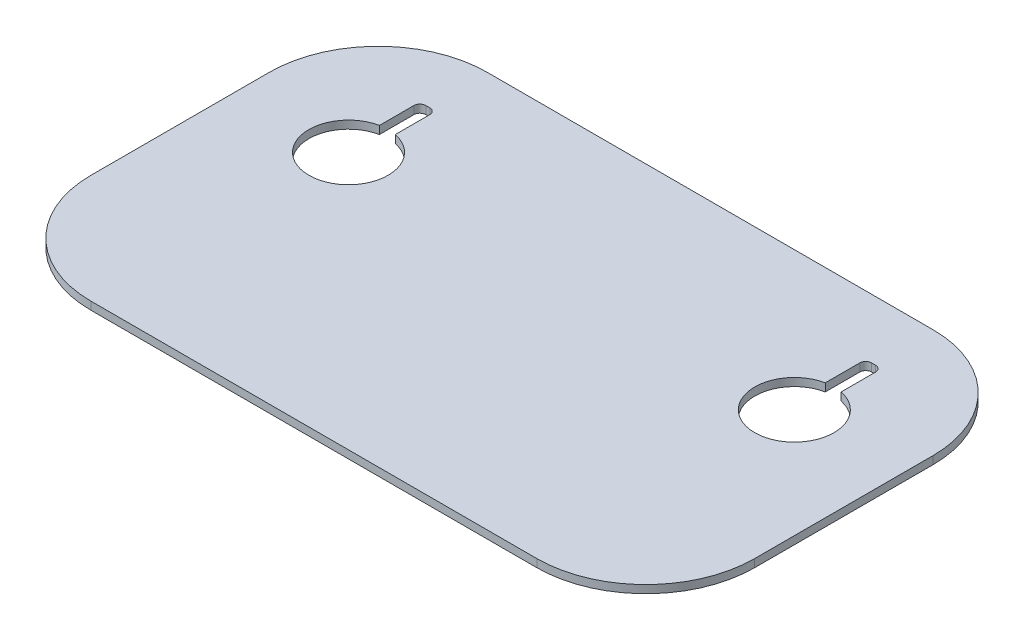
from build123d import *

# Parameters (mm, degrees)
BOSS_EXTRUDE1_DEPTH = 4
CUT_EXTRUDE1_DEPTH  = 391.180727356


with BuildPart() as part:
    # Sketch1 → Boss-Extrude1 (new body)
    with BuildSketch(Plane(origin=(0, 0, 0), x_dir=(1, 0, 0), z_dir=(0, 1, 0))):
        with BuildLine():
            Line((55, 0), (280, 0))
            ThreePointArc((280, 0), (318.890872965, 16.109127035), (335, 55))
            Line((335, 55), (335, 145))
            ThreePointArc((335, 145), (318.890872965, 183.890872965), (280, 200))
            Line((280, 200), (55, 200))
            ThreePointArc((55, 200), (16.109127035, 183.890872965), (0, 145))
            Line((0, 145), (0, 55))
            ThreePointArc((0, 55), (16.109127035, 16.109127035), (55, 0))
        make_face()
    extrude(amount=BOSS_EXTRUDE1_DEPTH)

    # Sketch3 → Cut-Extrude1 (cut, through all)
    with BuildSketch(Plane(origin=(0, 4, 0), x_dir=(1, 0, 0), z_dir=(0, 1, 0))):
        with BuildLine():
            Line((51, 167), (51, 149.595917942))
            ThreePointArc((51, 149.595917942), (55, 110), (59, 149.595917942))
            Line((59, 149.595917942), (59, 167))
            ThreePointArc((59, 167), (58.121320344, 169.121320344), (56, 170))
            Line((56, 170), (54, 170))
            ThreePointArc((54, 170), (51.878679656, 169.121320344), (51, 167))
        make_face()
        with BuildLine():
            Line((284, 167), (284, 149.595917942))
            ThreePointArc((284, 149.595917942), (280, 110), (276, 149.595917942))
            Line((276, 149.595917942), (276, 167))
            ThreePointArc((276, 167), (276.878679656, 169.121320344), (279, 170))
            Line((279, 170), (281, 170))
            ThreePointArc((281, 170), (283.121320344, 169.121320344), (284, 167))
        make_face()
    extrude(amount=-CUT_EXTRUDE1_DEPTH, mode=Mode.SUBTRACT)


solid = part.part
